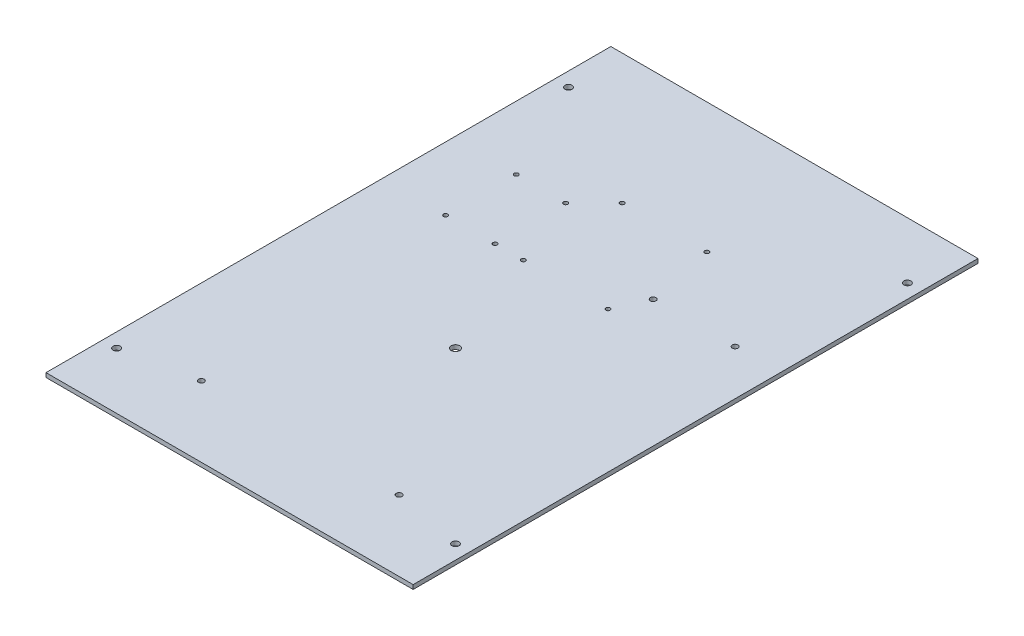
from build123d import *

# Parameters (mm, degrees)
SKETCH1_W           = 260
SKETCH1_H           = 400
SKETCH1_R           = 2.5
SKETCH1_R_2         = 2
SKETCH1_R_3         = 3
SKETCH1_R_4         = 1.5
BOSS_EXTRUDE1_DEPTH = 3


with BuildPart() as part:
    # Sketch1 → Boss-Extrude1 (new body)
    with BuildSketch(Plane(origin=(0, 0, 0), x_dir=(1, 0, 0), z_dir=(0, 1, 0))):
        with Locations((130, 200)):
            Rectangle(SKETCH1_W, SKETCH1_H)
        with Locations((10, 40)):
            Circle(SKETCH1_R, mode=Mode.SUBTRACT)
        with Locations((60, 50)):
            Circle(SKETCH1_R_2, mode=Mode.SUBTRACT)
        with Locations((250, 40)):
            Circle(SKETCH1_R, mode=Mode.SUBTRACT)
        with Locations((200, 50)):
            Circle(SKETCH1_R_2, mode=Mode.SUBTRACT)
        with Locations((130, 160)):
            Circle(SKETCH1_R_3, mode=Mode.SUBTRACT)
        with Locations((45, 238)):
            Circle(SKETCH1_R_4, mode=Mode.SUBTRACT)
        with Locations((45, 288)):
            Circle(SKETCH1_R_4, mode=Mode.SUBTRACT)
        with Locations((80, 238)):
            Circle(SKETCH1_R_4, mode=Mode.SUBTRACT)
        with Locations((100, 238)):
            Circle(SKETCH1_R_4, mode=Mode.SUBTRACT)
        with Locations((80, 288)):
            Circle(SKETCH1_R_4, mode=Mode.SUBTRACT)
        with Locations((10, 360)):
            Circle(SKETCH1_R, mode=Mode.SUBTRACT)
        with Locations((100, 308)):
            Circle(SKETCH1_R_4, mode=Mode.SUBTRACT)
        with Locations((160, 238)):
            Circle(SKETCH1_R_4, mode=Mode.SUBTRACT)
        with Locations((170, 260)):
            Circle(SKETCH1_R_2, mode=Mode.SUBTRACT)
        with Locations((228, 260)):
            Circle(SKETCH1_R_2, mode=Mode.SUBTRACT)
        with Locations((160, 308)):
            Circle(SKETCH1_R_4, mode=Mode.SUBTRACT)
        with Locations((250, 360)):
            Circle(SKETCH1_R, mode=Mode.SUBTRACT)
    extrude(amount=BOSS_EXTRUDE1_DEPTH)


solid = part.part
